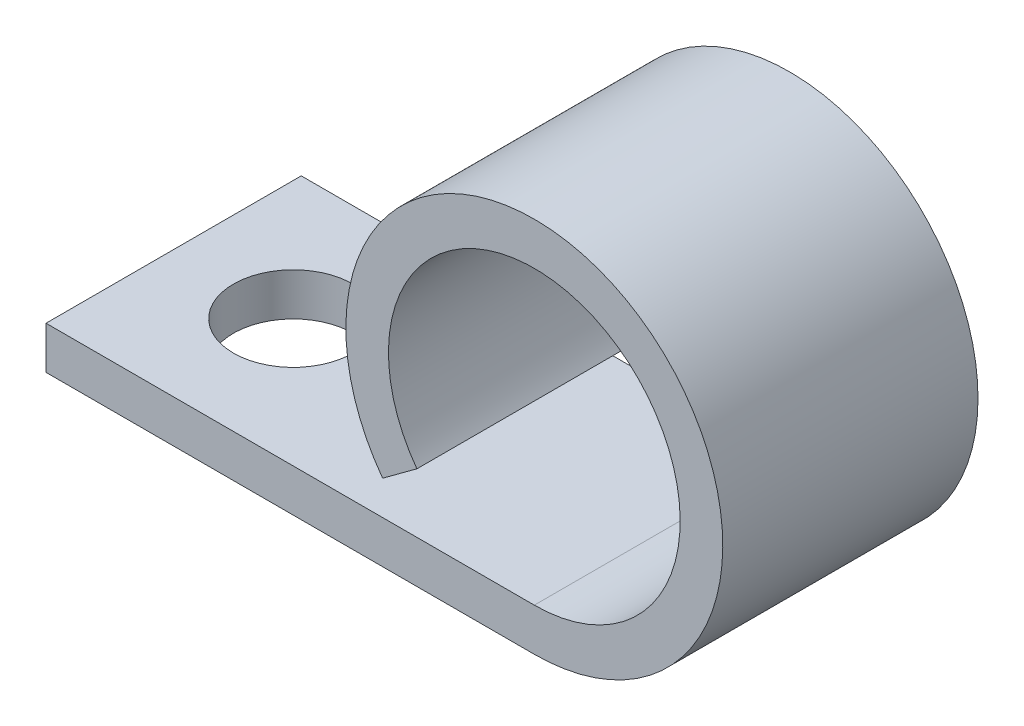
from build123d import *

# Parameters (mm, degrees)
BOSS_EXTRUDE1_DEPTH = 5.55625
SKETCH2_R           = 2.6035
CUT_EXTRUDE1_DEPTH  = 27.356702141


with BuildPart() as part:
    # Sketch1 → Boss-Extrude1 (new, symmetric)
    with BuildSketch(Plane.XY):
        with BuildLine():
            Line((-21.2598, -8.2042), (0, -8.2042))
            ThreePointArc((0, -8.2042), (3.700135792, 7.322423968), (-6.604900662, -4.86664))
            Line((-6.604900662, -4.86664), (-5.112152215, -3.766749226))
            ThreePointArc((-5.112152215, -3.766749226), (2.863882192, 5.667510811), (0, -6.35))
            Line((0, -6.35), (-21.2598, -6.35))
            Line((-21.2598, -6.35), (-21.2598, -8.2042))
        make_face()
    extrude(amount=BOSS_EXTRUDE1_DEPTH, both=True)

    # Sketch2 → Cut-Extrude1 (cut, through all)
    with BuildSketch(Plane(origin=(0, -6.35, 0), x_dir=(1, 0, 0), z_dir=(0, 1, 0))):
        with Locations((-16.0528, 0)):
            Circle(SKETCH2_R)
    extrude(amount=-CUT_EXTRUDE1_DEPTH, mode=Mode.SUBTRACT)


solid = part.part
